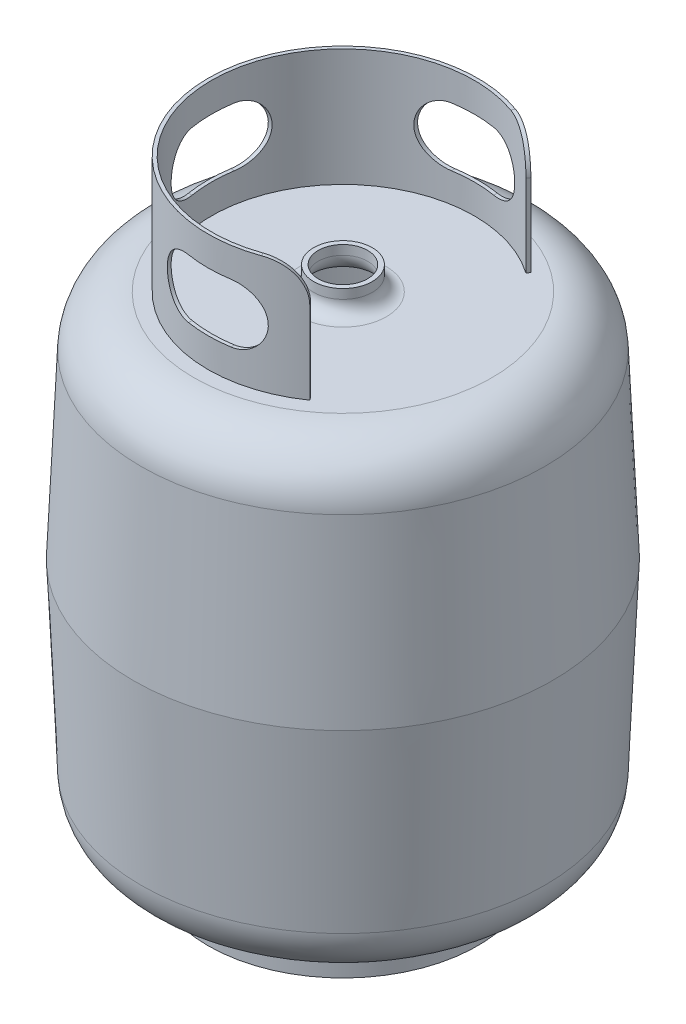
from build123d import *

# Parameters (mm, degrees)
SKETCH1_R           = 170
BOSS_EXTRUDE1_DEPTH = 197.5
BOSS_EXTRUDE1_DRAFT = -2.5
SKETCH2_R           = 178.623036224
BOSS_EXTRUDE2_DEPTH = 197.5
BOSS_EXTRUDE2_TAPER = 2.5
SKETCH3_R           = 25
BOSS_EXTRUDE3_DEPTH = 20
FILLET1_R           = 45
FILLET2_R           = 12
SKETCH4_R           = 114.921871599
SKETCH4_R_2         = 111.921871599
BOSS_EXTRUDE4_DEPTH = 30
BOSS_EXTRUDE5_START = 100
BOSS_EXTRUDE5_DEPTH = 100
FILLET3_R           = 30
CUT_EXTRUDE1_DEPTH  = 30
CIRPATTERN1_COUNT   = 3
CIRPATTERN1_ANGLE   = 180


# Read off the part's stored shape, not the designer's step: Shell1
with BuildPart() as part:
    # Sketch1 → Boss-Extrude1 (with draft: the straight prism first)
    with BuildSketch(Plane(origin=(0, 0, 0), x_dir=(1, 0, 0), z_dir=(0, 1, 0))):
        Circle(SKETCH1_R)
    extrude(amount=BOSS_EXTRUDE1_DEPTH)
    # Boss-Extrude1: the draft: its side faces are tilted about the plane it starts from
    boss_extrude1_sides = [part.faces().sort_by_distance(p)[0] for p in [
        (-170, 98.75, 0),
    ]]
    draft(boss_extrude1_sides, Plane(origin=(0, 0, 0), x_dir=(1, 0, 0), z_dir=(0, 1, 0)), BOSS_EXTRUDE1_DRAFT)

    # Sketch2 → Boss-Extrude2 (add)
    with BuildSketch(Plane(origin=(0, 197.5, 0), x_dir=(1, 0, 0), z_dir=(0, 1, 0))):
        Circle(SKETCH2_R)
    extrude(amount=BOSS_EXTRUDE2_DEPTH, taper=BOSS_EXTRUDE2_TAPER)

    # Sketch3 → Boss-Extrude3 (add)
    with BuildSketch(Plane(origin=(0, 395, 0), x_dir=(1, 0, 0), z_dir=(0, 1, 0))):
        with Locations(Location((0, 0, 0), (0, 0, 270))):
            Circle(SKETCH3_R)
    extrude(amount=BOSS_EXTRUDE3_DEPTH)

    # Fillet1
    fillet1_edges = [part.edges().sort_by_distance(p)[0] for p in [
        (-170, 0, 0),
        (-170, 395, 0),
    ]]
    fillet(fillet1_edges, radius=FILLET1_R)

    # Fillet2
    fillet2_edges = [part.edges().sort_by_distance(p)[0] for p in [
        (0, 395, -25),
    ]]
    fillet(fillet2_edges, radius=FILLET2_R)

    # Shell1 outline → Shell1 (revolve, cut)
    with BuildSketch(Plane.XY):
        with BuildLine():
            ThreePointArc((126.921871599, 4), (155.273906886, 15.383077556), (167.882848683, 43.211605118))
            Line((167.882848683, 43.211605118), (174.619225484, 197.5))
            Line((174.619225484, 197.5), (167.882848683, 351.788394882))
            ThreePointArc((167.882848683, 351.788394882), (155.273906886, 379.616922444), (126.921871599, 391))
            Line((126.921871599, 391), (37, 391))
            ThreePointArc((37, 391), (25.686291501, 395.686291501), (21, 407))
            Line((21, 407), (21, 415))
            Line((21, 415), (0, 415))
            Line((0, 415), (0, 4))
            Line((0, 4), (126.921871599, 4))
        make_face()
    revolve(axis=Axis((0, 0, 0), (0, 1, 0)), mode=Mode.SUBTRACT)

    # Sketch4 → Boss-Extrude4 (add)
    with BuildSketch(Plane.XZ):
        with Locations(Location((0, 0, 0), (0, 0, 90))):
            Circle(SKETCH4_R)
        with Locations(Location((0, 0, 0), (0, 0, 270))):
            Circle(SKETCH4_R_2, mode=Mode.SUBTRACT)
    extrude(amount=BOSS_EXTRUDE4_DEPTH)

    # Sketch5 → Boss-Extrude5 (add)
    with BuildSketch(Plane(origin=(0, 395, 0), x_dir=(1, 0, 0), z_dir=(0, 1, 0)).offset(BOSS_EXTRUDE5_START)):
        with BuildLine():
            ThreePointArc((64.195748261, -91.681029921), (-111.921871599, 0), (64.195748261, 91.681029921))
            Line((64.195748261, 91.681029921), (65.91647757, 94.138486053))
            ThreePointArc((65.91647757, 94.138486053), (-114.921871599, 0), (65.91647757, -94.138486053))
            Line((65.91647757, -94.138486053), (64.195748261, -91.681029921))
        make_face()
    extrude(amount=-BOSS_EXTRUDE5_DEPTH)

    # Fillet3
    # the kernel refuses this fillet: 30 mm, written as the material it takes off along each edge
    with BuildSketch(Plane(origin=(108.934710297, 495, 155.574889375), x_dir=(0, -1, 0), z_dir=(-0.573576436351044, 0, -0.8191520442889932))) as fillet3_piece_1_section:
        with BuildLine():
            CenterArc((FILLET3_R, FILLET3_R), FILLET3_R, 180, 90)
            Line((0, FILLET3_R), (-FILLET3_R * 0.02, FILLET3_R))
            Line((-FILLET3_R * 0.02, FILLET3_R), (-FILLET3_R * 0.02, -FILLET3_R * 0.02))
            Line((-FILLET3_R * 0.02, -FILLET3_R * 0.02), (FILLET3_R, -FILLET3_R * 0.02))
            Line((FILLET3_R, -FILLET3_R * 0.02), (FILLET3_R, 0))
        make_face()
    fillet3_piece_1 = extrude(amount=153, mode=Mode.PRIVATE)
    fillet3_piece_1 = fillet3_piece_1 & Plane(origin=(0, 488.225389067, 0), x_dir=(0.573576436351044, 0, -0.8191520442889932), z_dir=(0, 1, 0)) * Cylinder(114.921871599, 426, mode=Mode.PRIVATE)
    fillet3_piece_1 = fillet3_piece_1 - Plane(origin=(0, 488.225389067, 0), x_dir=(0.5735764363510444, 0, 0.819152044288993), z_dir=(0, 1, 0)) * Cylinder(111.921871599, 426, mode=Mode.PRIVATE)
    add(fillet3_piece_1, mode=Mode.SUBTRACT)
    with BuildSketch(Plane(origin=(21.177515535, 495, -30.244626599), x_dir=(0, -1, 0), z_dir=(0.5735764363510446, 0, -0.8191520442889928))) as fillet3_piece_2_section:
        with BuildLine():
            CenterArc((FILLET3_R, FILLET3_R), FILLET3_R, 180, 90)
            Line((0, FILLET3_R), (-FILLET3_R * 0.02, FILLET3_R))
            Line((-FILLET3_R * 0.02, FILLET3_R), (-FILLET3_R * 0.02, -FILLET3_R * 0.02))
            Line((-FILLET3_R * 0.02, -FILLET3_R * 0.02), (FILLET3_R, -FILLET3_R * 0.02))
            Line((FILLET3_R, -FILLET3_R * 0.02), (FILLET3_R, 0))
        make_face()
    fillet3_piece_2 = extrude(amount=153, mode=Mode.PRIVATE)
    fillet3_piece_2 = fillet3_piece_2 - Plane(origin=(0, 488.225329278, 0), x_dir=(0.5735764363510444, 0, 0.819152044288993), z_dir=(0, 1, 0)) * Cylinder(111.921871599, 427, mode=Mode.PRIVATE)
    fillet3_piece_2 = fillet3_piece_2 & Plane(origin=(0, 488.225329278, 0), x_dir=(0.573576436351044, 0, -0.8191520442889932), z_dir=(0, 1, 0)) * Cylinder(114.921871599, 427, mode=Mode.PRIVATE)
    add(fillet3_piece_2, mode=Mode.SUBTRACT)

    # Sketch6 → Cut-Extrude1 (cut)
    with BuildSketch(Plane.XY.offset(117)):
        with BuildLine():
            Line((-18, 470), (18, 470))
            ThreePointArc((18, 470), (43, 445), (18, 420))
            Line((18, 420), (-18, 420))
            ThreePointArc((-18, 420), (-43, 445), (-18, 470))
        make_face()
    cut_extrude1 = extrude(amount=-CUT_EXTRUDE1_DEPTH, mode=Mode.SUBTRACT)

    # CirPattern1: Cut-Extrude1 ×3 about axis
    cirpattern1_axis = Axis((0, 495, 0), (0, -1, 0))
    for i in range(1, CIRPATTERN1_COUNT):
        add(cut_extrude1.rotate(cirpattern1_axis, i * CIRPATTERN1_ANGLE / (CIRPATTERN1_COUNT - 1)), mode=Mode.SUBTRACT)


solid = part.part
